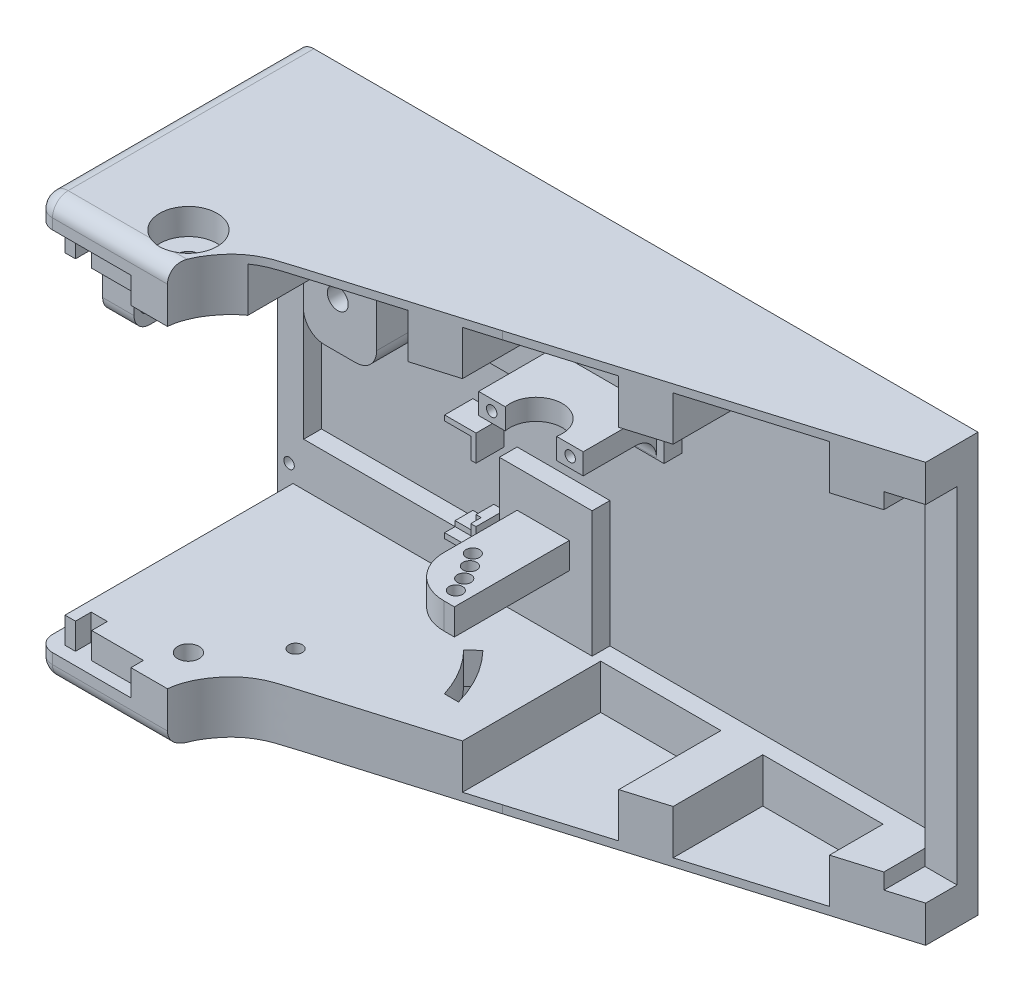
from build123d import *

# Parameters (mm, degrees)
SKETCH1_W            = 130
SKETCH1_H            = 80
EXTRUDE1_DEPTH       = 50
EXTRUDE2_DEPTH       = 110
SKETCH4_W            = 130
SKETCH4_H            = 60
EXTRUDE3_DEPTH       = 46
SKETCH7_W            = 3
SKETCH7_H            = 5
EXTRUDE6_DEPTH       = 46
SKETCH8_W            = 15
SKETCH8_H            = 5
EXTRUDE7_DEPTH       = 2.4
SKETCH11_R           = 2.05
EXTRUDE9_DEPTH       = 115.564392544
SKETCH12_R           = 5.5
EXTRUDE10_DEPTH      = 5
EXTRUDE11_DEPTH      = 3
SKETCH15_W           = 14
SKETCH15_H           = 18
EXTRUDE12_DEPTH      = 16
SKETCH16_R           = 2
EXTRUDE13_DEPTH      = 30
SKETCH17_R           = 1.3
EXTRUDE14_DEPTH      = 10
EXTRUDE15_DEPTH      = 10
SKETCH19_W           = 10
SKETCH19_H           = 5
EXTRUDE16_DEPTH      = 22
SKETCH21_R           = 1.3
EXTRUDE17_DEPTH      = 20
SKETCH22_R           = 3
EXTRUDE18_DEPTH      = 4
EXTRUDE19_DEPTH      = 4
FILLET3_R            = 8
FILLET4_R            = 2
SKETCH28_W           = 20
SKETCH28_H           = 4
EXTRUDE22_DEPTH      = 14
SKETCH29_R           = 5
EXTRUDE23_DEPTH      = 8
SKETCH34_R           = 1
EXTRUDE28_DEPTH      = 10
FILLET5_R            = 4
SKETCH32_W           = 23
SKETCH32_H           = 8.5
EXTRUDE26_DEPTH      = 90.112288884
LPATTERN1_COUNT      = 3
LPATTERN1_PITCH      = 31
SKETCH33_W           = 23
SKETCH33_H           = 8.5
EXTRUDE27_DEPTH      = 90.112288884
EXTRUDE25_DEPTH      = 3.4
SKETCH35_R           = 5.55
EXTRUDE29_DEPTH      = 15
FILLET6_R            = 4
SKETCH36_W           = 6
SKETCH36_H           = 11
EXTRUDE30_DEPTH      = 8
EXTRUDE31_DEPTH      = 6
SKETCH38_R           = 1.95
EXTRUDE32_DEPTH      = 13
FILLET7_R            = 3
EXTRUDE33_DEPTH      = 3.4
EXTRUDE34_DEPTH      = 2
SKETCH43_W           = 3.1
SKETCH43_H           = 5
EXTRUDE35_DEPTH      = 3
SKETCH44_R           = 1
EXTRUDE36_DEPTH      = 90.112288884
SKETCH45_R           = 1.9
EXTRUDE37_DEPTH      = 2.5
FILLET8_R            = 3
SKETCH46_R           = 1.5
EXTRUDE38_DEPTH      = 15
LPATTERN2_COUNT      = 2
LPATTERN2_PITCH      = 79
LPATTERN2_COUNT_DIR2 = 2
LPATTERN2_PITCH_DIR2 = 74


with BuildPart() as part:
    # Sketch1 → Extrude1 (new body)
    with BuildSketch(Plane.XY):
        Rectangle(SKETCH1_W, SKETCH1_H)
    extrude(amount=EXTRUDE1_DEPTH)

    # Sketch3 → Extrude2 (cut)
    with BuildSketch(Plane(origin=(0, 40, 0), x_dir=(-1, 0, 0), z_dir=(0, 1, 0))):
        with BuildLine():
            Line((-65, 10), (-65, 50))
            Line((-65, 50), (40, 50))
            add(Edge.make_bspline(
                [(40, 50), (39.890190944, 49.11018837), (39.71707827, 47.7074109), (38.153307558, 44.582420418), (35.866818019, 41.785570964), (33.299431334, 39.447554063), (21.450472775, 35.873990951), (8.497458472, 32.020851972), (-2.724125256, 28.682762423)],
                knots=[0, 0, 0, 0, 0.295314872, 0.46556039, 0.498904884, 0.614331489, 0.665883834, 1, 1, 1, 1], degree=3))
            Line((-2.724125256, 28.682762423), (-65, 10))
        make_face()
    extrude(amount=-EXTRUDE2_DEPTH, mode=Mode.SUBTRACT)

    # Sketch4 → Extrude3 (cut)
    with BuildSketch(Plane.XY.offset(50)):
        Rectangle(SKETCH4_W, SKETCH4_H)
    extrude(amount=-EXTRUDE3_DEPTH, mode=Mode.SUBTRACT)

    # Sketch7 → Extrude6 (cut)
    with BuildSketch(Plane.XY.offset(50)):
        with Locations((-63.5, 32.5)):
            Rectangle(SKETCH7_W, SKETCH7_H)
    extrude6 = extrude(amount=-EXTRUDE6_DEPTH, mode=Mode.SUBTRACT)

    # Sketch8 → Extrude7 (cut)
    with BuildSketch(Plane.XY.offset(50)):
        with Locations((-54.5, 32.5)):
            Rectangle(SKETCH8_W, SKETCH8_H)
    extrude7 = extrude(amount=-EXTRUDE7_DEPTH, mode=Mode.SUBTRACT)

    # Sketch11 → Extrude9 (cut, through all)
    with BuildSketch(Plane.XZ.offset(40)):
        with Locations(Location((-44, 42, 0), (0, 0, 270))):
            Circle(SKETCH11_R)
    extrude(amount=-EXTRUDE9_DEPTH, mode=Mode.SUBTRACT)

    # Sketch12 → Extrude10 (cut)
    with BuildSketch(Plane(origin=(0, 40, 0), x_dir=(-1, 0, 0), z_dir=(0, 1, 0))):
        with Locations(Location((44, 42, 0), (0, 0, 90))):
            Circle(SKETCH12_R)
    extrude10 = extrude(amount=-EXTRUDE10_DEPTH, mode=Mode.SUBTRACT)

    # Sketch13 → Extrude11 (cut)
    with BuildSketch(Plane.XZ.offset(-30)):
        Polygon((65, 4), (65, 10), (58.842556154, 11.847233154), (58.842556154, 4), align=None)
    extrude11 = extrude(amount=-EXTRUDE11_DEPTH, mode=Mode.SUBTRACT)

    # Mirror1: Extrude6, Extrude7, Extrude10, Extrude11 across plane
    add(extrude6.mirror(Plane.ZX), mode=Mode.SUBTRACT)
    add(extrude7.mirror(Plane.ZX), mode=Mode.SUBTRACT)
    add(extrude10.mirror(Plane.ZX), mode=Mode.SUBTRACT)
    add(extrude11.mirror(Plane.ZX), mode=Mode.SUBTRACT)

    # Sketch15 → Extrude12 (add)
    with BuildSketch(Plane.XY.offset(4)):
        with Locations((-37, 21)):
            Rectangle(SKETCH15_W, SKETCH15_H)
    extrude(amount=EXTRUDE12_DEPTH)

    # Sketch16 → Extrude13 (cut)
    with BuildSketch(Plane.XY.offset(20)):
        with Locations((-37.434652281, 20.911661038)):
            Circle(SKETCH16_R)
    extrude(amount=-EXTRUDE13_DEPTH, mode=Mode.SUBTRACT)

    # Sketch17 → Extrude14 (cut)
    with BuildSketch(Plane.XZ.offset(40)):
        with Locations(Location((-34.395430578, 31.114583093, 0), (0, 0, 270))):
            Circle(SKETCH17_R)
    extrude(amount=-EXTRUDE14_DEPTH, mode=Mode.SUBTRACT)

    # Sketch18 → Extrude15 (cut)
    with BuildSketch(Plane.XZ.offset(40)):
        with BuildLine():
            Line((-12.680215707, 24.364987321), (-9.970882334, 24.364987321))
            ThreePointArc((-9.970882334, 24.364987321), (-12.404591086, 18.524166959), (-16.209504474, 13.468402438))
            Line((-16.209504474, 13.468402438), (-18.075463743, 15.278981353))
            ThreePointArc((-18.075463743, 15.278981353), (-14.842741812, 19.50424451), (-12.680215707, 24.364987321))
        make_face()
    extrude(amount=-EXTRUDE15_DEPTH, mode=Mode.SUBTRACT)

    # Sketch19 → Extrude16 (add)
    with BuildSketch(Plane.XY.offset(4)):
        with Locations((-14.13707553, -15.5)):
            Rectangle(SKETCH19_W, SKETCH19_H)
    extrude(amount=EXTRUDE16_DEPTH)

    # Sketch21 → Extrude17 (cut)
    with BuildSketch(Plane.XZ.offset(18)):
        with Locations(Location((-11.717186472, 23.138440903, 0), (0, 0, 270))):
            Circle(SKETCH21_R)
        with Locations(Location((-12.887190504, 20.375998041, 0), (0, 0, 270))):
            Circle(SKETCH21_R)
        with Locations(Location((-14.392143361, 17.780787665, 0), (0, 0, 270))):
            Circle(SKETCH21_R)
        with Locations(Location((-16.208608342, 15.393225106, 0), (0, 0, 270))):
            Circle(SKETCH21_R)
    extrude(amount=-EXTRUDE17_DEPTH, mode=Mode.SUBTRACT)

    # Sketch22 → Extrude18 (cut)
    with BuildSketch(Plane.XZ.offset(40)):
        with Locations(Location((-34.395430578, 31.114583093, 0), (0, 0, 270))):
            Circle(SKETCH22_R)
    extrude(amount=-EXTRUDE18_DEPTH, mode=Mode.SUBTRACT)

    # Sketch23 → Extrude19 (cut)
    with BuildSketch(Plane.XZ.offset(40)):
        with BuildLine():
            Line((-6.304575633, 27.364987321), (-15.014818319, 27.364987321))
            ThreePointArc((-15.014818319, 27.364987321), (-17.639302665, 20.679077482), (-22.482183028, 15.374756766))
            Line((-22.482183028, 15.374756766), (-16.259882236, 9.33712947))
            ThreePointArc((-16.259882236, 9.33712947), (-9.586742485, 17.414780354), (-6.304575633, 27.364987321))
        make_face()
    extrude(amount=-EXTRUDE19_DEPTH, mode=Mode.SUBTRACT)

    # Fillet3
    fillet3_edges = [part.edges().sort_by_distance(p)[0] for p in [
        (-19.13707553, -15.5, 26),
    ]]
    fillet(fillet3_edges, radius=FILLET3_R)

    # Fillet4
    fillet4_edges = [part.edges().sort_by_distance(p)[0] for p in [
        (-6.304575633, -38, 27.364987321),
        (-16.259882236, -38, 9.33712947),
        (-22.482183028, -38, 15.374756766),
        (-15.014818319, -38, 27.364987321),
    ]]
    fillet(fillet4_edges, radius=FILLET4_R)

    # Sketch28 → Extrude22 (add)
    with BuildSketch(Plane.XY.offset(4)):
        with Locations((-2.5, 15)):
            Rectangle(SKETCH28_W, SKETCH28_H)
    extrude(amount=EXTRUDE22_DEPTH)

    # Sketch29 → Extrude23 (cut)
    with BuildSketch(Plane.XZ.offset(-13)):
        with Locations((-2.5, 17)):
            Circle(SKETCH29_R)
    extrude(amount=-EXTRUDE23_DEPTH, mode=Mode.SUBTRACT)

    # Sketch34 → Extrude28 (cut)
    with BuildSketch(Plane.XY.offset(18)):
        with Locations((-10, 15)):
            Circle(SKETCH34_R)
        with Locations((5, 15)):
            Circle(SKETCH34_R)
    extrude(amount=-EXTRUDE28_DEPTH, mode=Mode.SUBTRACT)

    # Fillet5
    fillet5_edges = [part.edges().sort_by_distance(p)[0] for p in [
        (-2.5, 13, 4),
    ]]
    fillet(fillet5_edges, radius=FILLET5_R)

    # Sketch32 → Extrude26 (cut, through all)
    with BuildSketch(Plane.XY.offset(4)):
        with Locations((39.342556154, 34.25)):
            Rectangle(SKETCH32_W, SKETCH32_H)
    extrude26 = extrude(amount=EXTRUDE26_DEPTH, mode=Mode.SUBTRACT)

    # LPattern1: Extrude26 ×3
    with Locations(*[(-i * LPATTERN1_PITCH, 0, 0) for i in range(1, LPATTERN1_COUNT)]):
        add(extrude26, mode=Mode.SUBTRACT)

    # Mirror2: Extrude26 across plane
    add(extrude26.mirror(Plane.ZX), mode=Mode.SUBTRACT)

    # Sketch33 → Extrude27 (cut, through all)
    with BuildSketch(Plane.XY.offset(4)):
        with Locations((8.342556154, -34.25)):
            Rectangle(SKETCH33_W, SKETCH33_H)
    extrude(amount=EXTRUDE27_DEPTH, mode=Mode.SUBTRACT)

    # Sketch31 → Extrude25 (cut)
    with BuildSketch(Plane.XY.offset(4)):
        Polygon((58.842556154, 30), (8.953553986, 30), (8.953553986, 8.775505095), (-44.185721769, 8.775505095), (-44.185721769, 27.042069814), (-59.954714807, 27.042069814), (-59.954714807, -21.647156304), (-22.531701561, -21.647156304), (-22.531701561, -5.921378129), (-4.795724039, -5.921378129), (-4.795724039, -30), (58.842556154, -30), align=None)
    extrude(amount=-EXTRUDE25_DEPTH, mode=Mode.SUBTRACT)

    # Sketch35 → Extrude29 (cut)
    with BuildSketch(Plane(origin=(0, 0, 0), x_dir=(-1, 0, 0), z_dir=(0, 0, -1))):
        with Locations((37.434652281, 20.911661038)):
            Circle(SKETCH35_R)
    extrude(amount=-EXTRUDE29_DEPTH, mode=Mode.SUBTRACT)

    # Fillet6
    fillet6_edges = [part.edges().sort_by_distance(p)[0] for p in [
        (-44, 12, 12),
        (-30, 12, 12),
        (-30, 30, 12),
    ]]
    fillet(fillet6_edges, radius=FILLET6_R)

    # Sketch36 → Extrude30 (add)
    with BuildSketch(Plane(origin=(0, 30, 0), x_dir=(-1, 0, 0), z_dir=(0, 1, 0))):
        with Locations((53, 40.9)):
            Rectangle(SKETCH36_W, SKETCH36_H)
    extrude(amount=-EXTRUDE30_DEPTH)

    # Sketch37 → Extrude31 (add)
    with BuildSketch(Plane.ZY.offset(56)):
        Polygon((35.4, 22), (26.4, 30), (35.4, 30), align=None)
    extrude(amount=-EXTRUDE31_DEPTH)

    # Sketch38 → Extrude32 (cut)
    with BuildSketch(Plane.ZY.offset(56)):
        with Locations(Location((43.4, 26, 0), (0, 0, 270))):
            Circle(SKETCH38_R)
        with Locations(Location((35.9, 26, 0), (0, 0, 270))):
            Circle(SKETCH38_R)
    extrude(amount=-EXTRUDE32_DEPTH, mode=Mode.SUBTRACT)

    # Fillet7
    fillet7_edges = [part.edges().sort_by_distance(p)[0] for p in [
        (-53, 22, 35.4),
        (-53, 22, 46.4),
    ]]
    fillet(fillet7_edges, radius=FILLET7_R)

    # Sketch40 → Extrude33 (add)
    with BuildSketch(Plane.XY.offset(0.6)):
        Polygon((-25, -2.147156304), (-31, -2.147156304), (-31, -4.147156304), (-27, -4.147156304), (-27, -7.147156304), (-25, -7.147156304), align=None)
        Polygon((-25, -22.647156304), (-31, -22.647156304), (-31, -20.647156304), (-27, -20.647156304), (-27, -17.647156304), (-25, -17.647156304), align=None)
    extrude(amount=EXTRUDE33_DEPTH)

    # Sketch41 → Extrude34 (add)
    with BuildSketch(Plane.XY.offset(4)):
        Polygon((-25, -17.647156304), (-25, -22.647156304), (-31, -22.647156304), (-31, -21.647156304), (-26, -21.647156304), (-26, -17.647156304), align=None)
        Polygon((-25, -7.147156304), (-25, -2.147156304), (-31, -2.147156304), (-31, -3.147156304), (-26, -3.147156304), (-26, -7.147156304), align=None)
    extrude(amount=EXTRUDE34_DEPTH)

    # Sketch43 → Extrude35 (cut)
    with BuildSketch(Plane.XY.offset(47.6)):
        with Locations((-58.45, 32.5)):
            Rectangle(SKETCH43_W, SKETCH43_H)
        with Locations((-58.45, -32.5)):
            Rectangle(SKETCH43_W, SKETCH43_H)
    extrude(amount=-EXTRUDE35_DEPTH, mode=Mode.SUBTRACT)

    # Sketch44 → Extrude36 (cut, through all)
    with BuildSketch(Plane.XY.offset(4)):
        with Locations((-62.75, 27)):
            Circle(SKETCH44_R)
    extrude36 = extrude(amount=-EXTRUDE36_DEPTH, mode=Mode.SUBTRACT)

    # Mirror3: Extrude36 across plane
    add(extrude36.mirror(Plane.ZX), mode=Mode.SUBTRACT)

    # Sketch45 → Extrude37 (cut)
    with BuildSketch(Plane(origin=(0, 0, 0), x_dir=(-1, 0, 0), z_dir=(0, 0, -1))):
        with Locations((62.75, 27)):
            Circle(SKETCH45_R)
        with Locations((62.75, -27)):
            Circle(SKETCH45_R)
    extrude(amount=-EXTRUDE37_DEPTH, mode=Mode.SUBTRACT)

    # Fillet8
    # the kernel refuses this fillet: 3 mm, written as the material it takes off along each edge
    with BuildSketch(Plane(origin=(-62, -37, 47), x_dir=(0, -1, 0), z_dir=(-1, 0, 0))) as fillet8_piece_1_section:
        Polygon((0, 0), (FILLET8_R, 0), (FILLET8_R, FILLET8_R), (0, FILLET8_R), align=None)
    fillet8_piece_1 = extrude(amount=FILLET8_R, mode=Mode.PRIVATE)
    fillet8_piece_1 = fillet8_piece_1 - Plane(origin=(-62, -37, 47), x_dir=(0, 0.7071067811865475, -0.7071067811865475), z_dir=(-1, 0, 0)) * Sphere(FILLET8_R, mode=Mode.PRIVATE)
    add(fillet8_piece_1, mode=Mode.SUBTRACT)
    with BuildSketch(Plane(origin=(-62, 37, 47), x_dir=(0, 0, 1), z_dir=(-1, 0, 0))) as fillet8_piece_2_section:
        Polygon((0, 0), (FILLET8_R, 0), (FILLET8_R, FILLET8_R), (0, FILLET8_R), align=None)
    fillet8_piece_2 = extrude(amount=FILLET8_R, mode=Mode.PRIVATE)
    fillet8_piece_2 = fillet8_piece_2 - Plane(origin=(-62, 37, 47), x_dir=(0, -0.7071067811865475, -0.7071067811865475), z_dir=(-1, 0, 0)) * Sphere(FILLET8_R, mode=Mode.PRIVATE)
    add(fillet8_piece_2, mode=Mode.SUBTRACT)
    with BuildSketch(Plane(origin=(-65, -37, 50), x_dir=(0, 0, -1), z_dir=(0, 1, 0))) as fillet8_piece_3:
        with BuildLine():
            CenterArc((FILLET8_R, -FILLET8_R), FILLET8_R, 90, 90)
            Line((0, -FILLET8_R), (0, 0))
            Line((0, 0), (FILLET8_R, 0))
        make_face()
    extrude(amount=9.5, mode=Mode.SUBTRACT)
    with BuildSketch(Plane(origin=(-62, 40, 50), x_dir=(0, -1, 0), z_dir=(1, 0, 0))) as fillet8_piece_4:
        with BuildLine():
            CenterArc((FILLET8_R, FILLET8_R), FILLET8_R, 180, 90)
            Line((0, FILLET8_R), (0, 0))
            Line((0, 0), (FILLET8_R, 0))
        make_face()
    extrude(amount=29.5, mode=Mode.SUBTRACT)
    with BuildSketch(Plane(origin=(-65, 27.5, 50), x_dir=(1, 0, 0), z_dir=(0, 1, 0))) as fillet8_piece_5:
        with BuildLine():
            CenterArc((FILLET8_R, FILLET8_R), FILLET8_R, 180, 90)
            Line((0, FILLET8_R), (0, 0))
            Line((0, 0), (FILLET8_R, 0))
        make_face()
    extrude(amount=9.5, mode=Mode.SUBTRACT)
    with BuildSketch(Plane(origin=(-32.5, -40, 50), x_dir=(0, 0, -1), z_dir=(-1, 0, 0))) as fillet8_piece_6:
        with BuildLine():
            CenterArc((FILLET8_R, -FILLET8_R), FILLET8_R, 90, 90)
            Line((0, -FILLET8_R), (0, 0))
            Line((0, 0), (FILLET8_R, 0))
        make_face()
    extrude(amount=29.5, mode=Mode.SUBTRACT)
    with BuildSketch(Plane(origin=(-65, 40, -7.5), x_dir=(0, -1, 0), z_dir=(0, 0, 1))) as fillet8_piece_7:
        with BuildLine():
            CenterArc((FILLET8_R, FILLET8_R), FILLET8_R, 180, 90)
            Line((0, FILLET8_R), (0, 0))
            Line((0, 0), (FILLET8_R, 0))
        make_face()
    extrude(amount=54.5, mode=Mode.SUBTRACT)
    with BuildSketch(Plane(origin=(-65, -40, -7.5), x_dir=(0, 1, 0), z_dir=(0, 0, 1))) as fillet8_piece_8:
        with BuildLine():
            CenterArc((FILLET8_R, -FILLET8_R), FILLET8_R, 90, 90)
            Line((0, -FILLET8_R), (0, 0))
            Line((0, 0), (FILLET8_R, 0))
        make_face()
    extrude(amount=54.5, mode=Mode.SUBTRACT)

    # Sketch46 → Extrude38 (cut)
    with BuildSketch(Plane(origin=(0, 0, 0), x_dir=(-1, 0, 0), z_dir=(0, 0, -1))):
        with Locations((55, 37)):
            Circle(SKETCH46_R)
    extrude38 = extrude(amount=-EXTRUDE38_DEPTH, mode=Mode.SUBTRACT)

    # LPattern2: Extrude38 2 × 2
    with Locations(*[(i * LPATTERN2_PITCH, -j * LPATTERN2_PITCH_DIR2, 0) for i in range(LPATTERN2_COUNT) for j in range(LPATTERN2_COUNT_DIR2) if (i, j) != (0, 0)]):
        add(extrude38, mode=Mode.SUBTRACT)


solid = part.part
